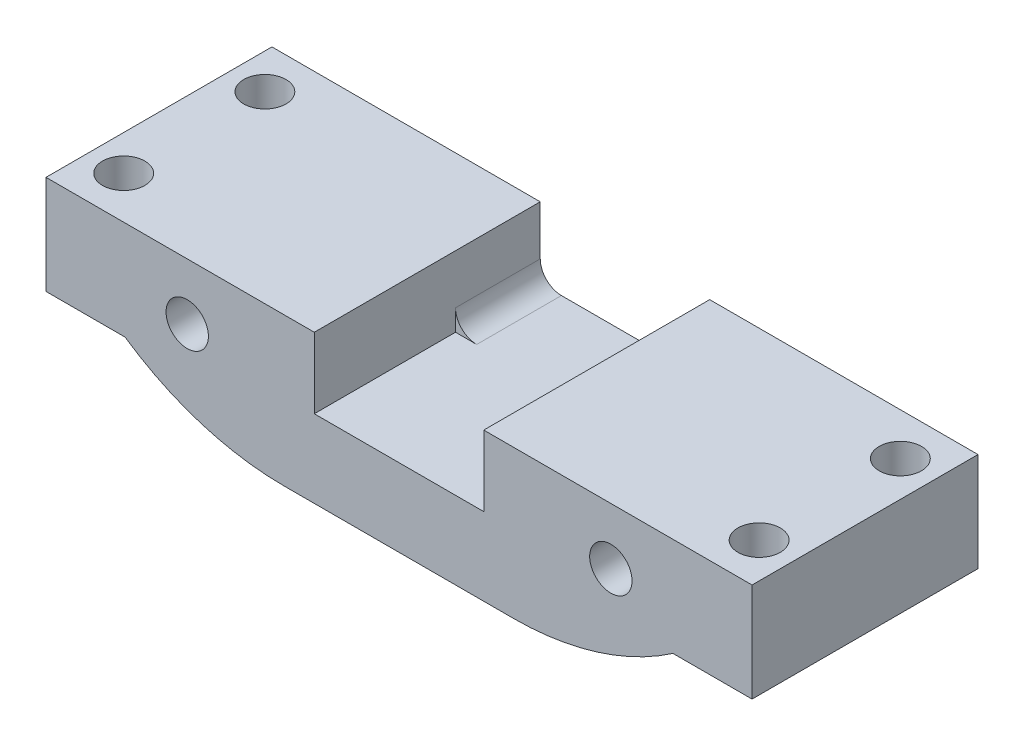
from build123d import *
from build123d.topology import SkipClean

# Parameters (mm, degrees)
SKETCH7_R               = 1.5
BOSS_EXTRUDE11_DEPTH    = 10
FILLET1_R               = 20
BOSS_EXTRUDE12_START    = 6
BOSS_EXTRUDE12_DEPTH    = 6
CUT_EXTRUDE1_DEPTH      = 51.142297514
CUT_EXTRUDE1_DEPTH_BACK = 51.142297514
SKETCH10_R              = 1.5


with BuildPart() as part:
    # Sketch7 → Boss-Extrude11 (new body)
    with BuildSketch(Plane.XY):
        Polygon((11, 14.9), (-2, 14.9), (-2, 7.9), (3.598076211, 7.9), (3.598076211, 4.4), (42.4, 4.4), (42.4, 7.9), (48, 7.9), (48, 14.9), (35, 14.9), (29, 14.9), (29, 9.9), (17, 9.9), (17, 14.9), align=None)
        with Locations((8, 10.9)):
            Circle(SKETCH7_R, mode=Mode.SUBTRACT)
        with Locations((38, 10.9)):
            Circle(SKETCH7_R, mode=Mode.SUBTRACT)
    extrude(amount=BOSS_EXTRUDE11_DEPTH)

    # Fillet1
    # the kernel refuses this fillet: 20 mm, written as the material it takes off along each edge
    with BuildSketch(Plane(origin=(42.4, 4.4, -28.256636389), x_dir=(-1.4210854715172548e-12, 1.0, 0), z_dir=(0, 0, 1))) as fillet1_piece_1:
        with BuildLine():
            CenterArc((20, 11.302654555), FILLET1_R, 180, 34.41150867)
            Line((0, 11.302654555), (-0.4, 11.302654555))
            Line((-0.4, 11.302654555), (-0.4, 0))
            Line((-0.4, 0), (0, -0.4))
            ThreePointArc((0, -0.4), (1.75, -0.4), (3.17, -0.226053091))
            Line((3.17, -0.226053091), (3.5, 0))
        make_face()
    extrude(amount=66.513272777, mode=Mode.SUBTRACT)
    with BuildSketch(Plane(origin=(3.598076211, 4.4, -28.256636389), x_dir=(1, 0, 0), z_dir=(0, 0, 1))) as fillet1_piece_2:
        with BuildLine():
            CenterArc((11.302654555, 20), FILLET1_R, 235.58849133, 34.41150867)
            Line((0, 3.5), (-0.226053091, 3.17))
            ThreePointArc((-0.226053091, 3.17), (-0.4, 1.75), (-0.4, 0))
            Line((-0.4, 0), (0, -0.4))
            Line((0, -0.4), (11.302654555, -0.4))
            Line((11.302654555, -0.4), (11.302654555, 0))
        make_face()
    extrude(amount=66.513272777, mode=Mode.SUBTRACT)

    # Sketch9 → Boss-Extrude12 (add)
    with SkipClean():  # the faces are left unmerged after this step: merging them gives an invalid solid
        with BuildSketch(Plane(origin=(0, 0, 0), x_dir=(-1, 0, 0), z_dir=(0, 0, -1)).offset(BOSS_EXTRUDE12_START)):
            with BuildLine():
                Line((-48, 7.9), (-42.4, 7.9))
                ThreePointArc((-42.4, 7.9), (-37.013425228, 5.295026825), (-31.097345445, 4.4))
                Line((-31.097345445, 4.4), (-14.900730767, 4.4))
                ThreePointArc((-14.900730767, 4.4), (-8.984650984, 5.295026825), (-3.598076211, 7.9))
                Line((-3.598076211, 7.9), (2, 7.9))
                Line((2, 7.9), (2, 14.9))
                Line((2, 14.9), (-17, 14.9))
                Line((-17, 14.9), (-17, 11.4))
                ThreePointArc((-17, 11.4), (-17.439339828, 10.339339828), (-18.5, 9.9))
                Line((-18.5, 9.9), (-27.5, 9.9))
                ThreePointArc((-27.5, 9.9), (-28.560660172, 10.339339828), (-29, 11.4))
                Line((-29, 11.4), (-29, 14.9))
                Line((-29, 14.9), (-48, 14.9))
                Line((-48, 14.9), (-48, 7.9))
            make_face()
        extrude(amount=-BOSS_EXTRUDE12_DEPTH)

    # Sketch10 → Cut-Extrude1 (cut, two sides: drawn at the far end of the back side and taken through both)
    with SkipClean():  # the faces are left unmerged after this step: merging them gives an invalid solid
        with BuildSketch(Plane(origin=(0, 14.9, 0), x_dir=(1, 0, 0), z_dir=(0, 1, 0)).offset(-CUT_EXTRUDE1_DEPTH_BACK)):
            with Locations(Location((0.5, -7, 0), (0, 0, 180))):
                Circle(SKETCH10_R)
            with Locations(Location((0.5, 3, 0), (0, 0, 180))):
                Circle(SKETCH10_R)
            with Locations(Location((45.5, -7, 0), (0, 0, 180))):
                Circle(SKETCH10_R)
            with Locations(Location((45.5, 3, 0), (0, 0, 180))):
                Circle(SKETCH10_R)
        extrude(amount=CUT_EXTRUDE1_DEPTH + CUT_EXTRUDE1_DEPTH_BACK, mode=Mode.SUBTRACT)


solid = part.part
